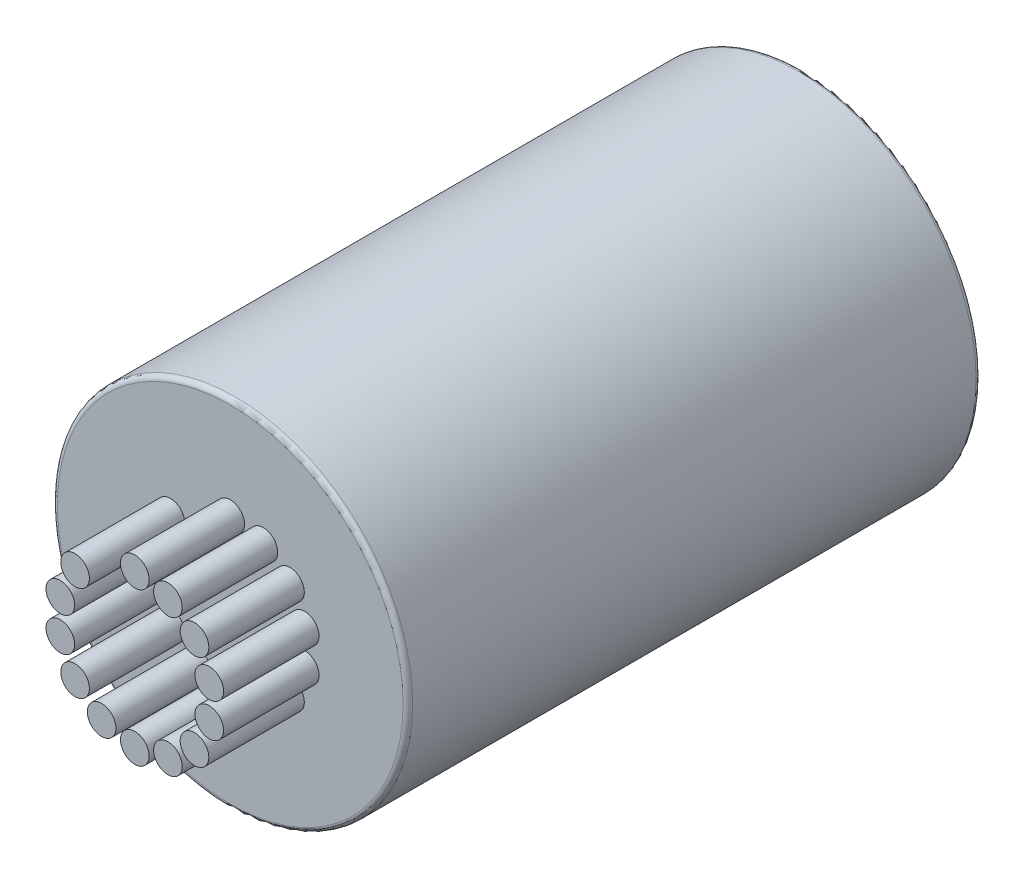
from build123d import *

# Parameters (mm, degrees)
SKETCH1_R           = 9.3
BOSS_EXTRUDE1_DEPTH = 30
SKETCH2_R           = 7.5
CUT_EXTRUDE1_DEPTH  = 0.1
SKETCH3_R           = 0.75
BOSS_EXTRUDE2_DEPTH = 5
FILLET1_R           = 0.25


with BuildPart() as part:
    # Sketch1 → Boss-Extrude1 (new body)
    with BuildSketch(Plane.XY):
        Circle(SKETCH1_R)
    extrude(amount=BOSS_EXTRUDE1_DEPTH)

    # Sketch2 → Cut-Extrude1 (cut)
    with BuildSketch(Plane(origin=(0, 0, 0), x_dir=(-1, 0, 0), z_dir=(0, 0, -1))):
        Circle(SKETCH2_R)
    extrude(amount=-CUT_EXTRUDE1_DEPTH, mode=Mode.SUBTRACT)

    # Sketch3 → Boss-Extrude2 (add)
    with BuildSketch(Plane.XY.offset(30)):
        with Locations((0, 4)):
            Circle(SKETCH3_R)
        with Locations((1.735534956, 3.603875472)):
            Circle(SKETCH3_R)
        with Locations((3.12732593, 2.493959207)):
            Circle(SKETCH3_R)
        with Locations((3.899711649, 0.890083736)):
            Circle(SKETCH3_R)
        with Locations((3.899711649, -0.890083736)):
            Circle(SKETCH3_R)
        with Locations((3.12732593, -2.493959207)):
            Circle(SKETCH3_R)
        with Locations((1.735534956, -3.603875472)):
            Circle(SKETCH3_R)
        with Locations((0, -4)):
            Circle(SKETCH3_R)
        with Locations((-1.735534956, -3.603875472)):
            Circle(SKETCH3_R)
        with Locations((-3.12732593, -2.493959207)):
            Circle(SKETCH3_R)
        with Locations((-3.899711649, -0.890083736)):
            Circle(SKETCH3_R)
        with Locations((-3.899711649, 0.890083736)):
            Circle(SKETCH3_R)
        with Locations((-3.12732593, 2.493959207)):
            Circle(SKETCH3_R)
    extrude(amount=BOSS_EXTRUDE2_DEPTH)

    # Fillet1
    fillet1_edges = [part.edges().sort_by_distance(p)[0] for p in [
        (-9.3, 0, 30),
        (-9.3, 0, 0),
    ]]
    fillet(fillet1_edges, radius=FILLET1_R)


solid = part.part
